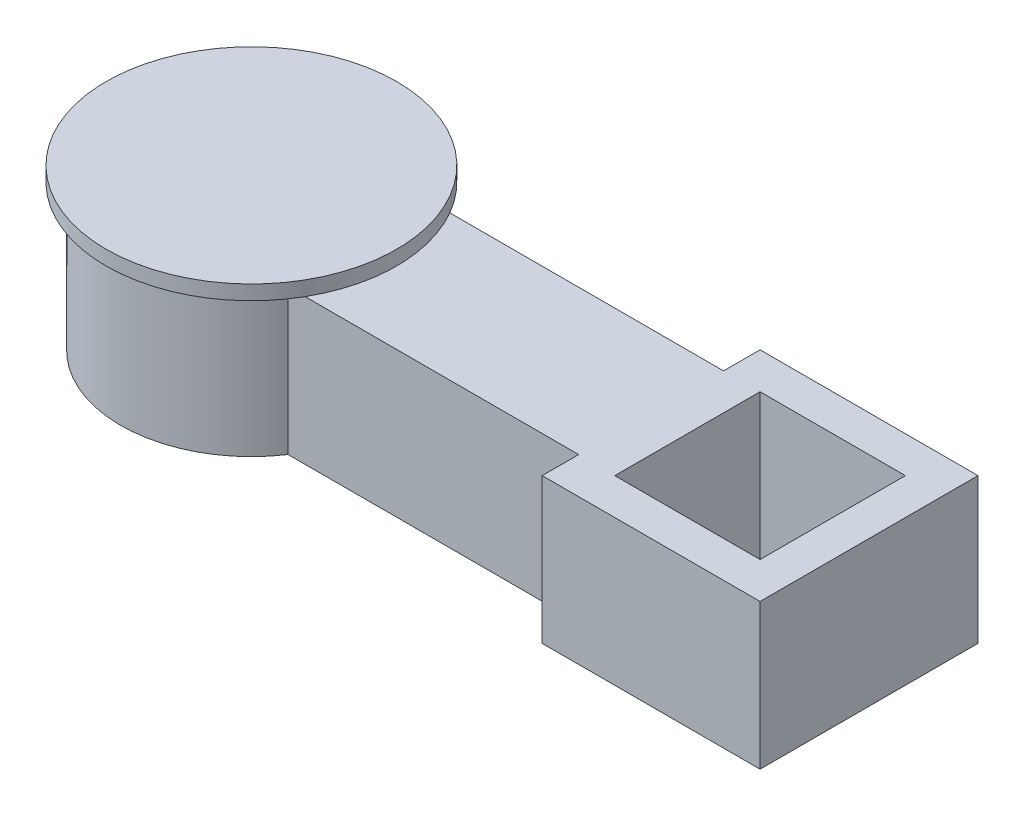
from build123d import *

# Parameters (mm, degrees)
BOSS_EXTRUDE1_DEPTH = 100
SKETCH5_R           = 70
CUT_EXTRUDE2_DEPTH  = 100
SKETCH6_R           = 100
BOSS_EXTRUDE4_DEPTH = 10
SKETCH7_W           = 100
SKETCH7_H           = 100
CUT_EXTRUDE3_DEPTH  = 100


with BuildPart() as part:
    # Sketch1 → Boss-Extrude1 (new body)
    with BuildSketch(Plane(origin=(0, 0, 0), x_dir=(1, 0, 0), z_dir=(0, 1, 0))):
        with BuildLine():
            Line((363.145565834, 275.992438563), (363.145565834, 275.741810419))
            ThreePointArc((363.145565834, 275.741810419), (198.145565834, 225.992438563), (363.145565834, 176.243066708))
            Line((363.145565834, 176.243066708), (563.145565834, 176.243066708))
            Line((563.145565834, 176.243066708), (563.145565834, 151.117752636))
            Line((563.145565834, 151.117752636), (713.145565834, 151.117752636))
            Line((713.145565834, 151.117752636), (713.145565834, 301.117752636))
            Line((713.145565834, 301.117752636), (563.145565834, 301.117752636))
            Line((563.145565834, 301.117752636), (563.145565834, 275.992438563))
            Line((563.145565834, 275.992438563), (363.145565834, 275.992438563))
        make_face()
    extrude(amount=BOSS_EXTRUDE1_DEPTH)

    # Sketch5 → Cut-Extrude2 (cut)
    with BuildSketch(Plane(origin=(0, 100, 0), x_dir=(1, 0, 0), z_dir=(0, 1, 0))):
        with Locations((288.145565834, 225.992438563)):
            Circle(SKETCH5_R)
    extrude(amount=-CUT_EXTRUDE2_DEPTH, mode=Mode.SUBTRACT)

    # Sketch6 → Boss-Extrude4 (add)
    with BuildSketch(Plane(origin=(0, 100, 0), x_dir=(1, 0, 0), z_dir=(0, 1, 0))):
        with Locations((288.145565834, 225.992438563)):
            Circle(SKETCH6_R)
    extrude(amount=BOSS_EXTRUDE4_DEPTH)

    # Sketch7 → Cut-Extrude3 (cut)
    with BuildSketch(Plane(origin=(0, 100, 0), x_dir=(1, 0, 0), z_dir=(0, 1, 0))):
        with Locations((638.145565834, 226.117752636)):
            Rectangle(SKETCH7_W, SKETCH7_H)
    extrude(amount=-CUT_EXTRUDE3_DEPTH, mode=Mode.SUBTRACT)


solid = part.part
